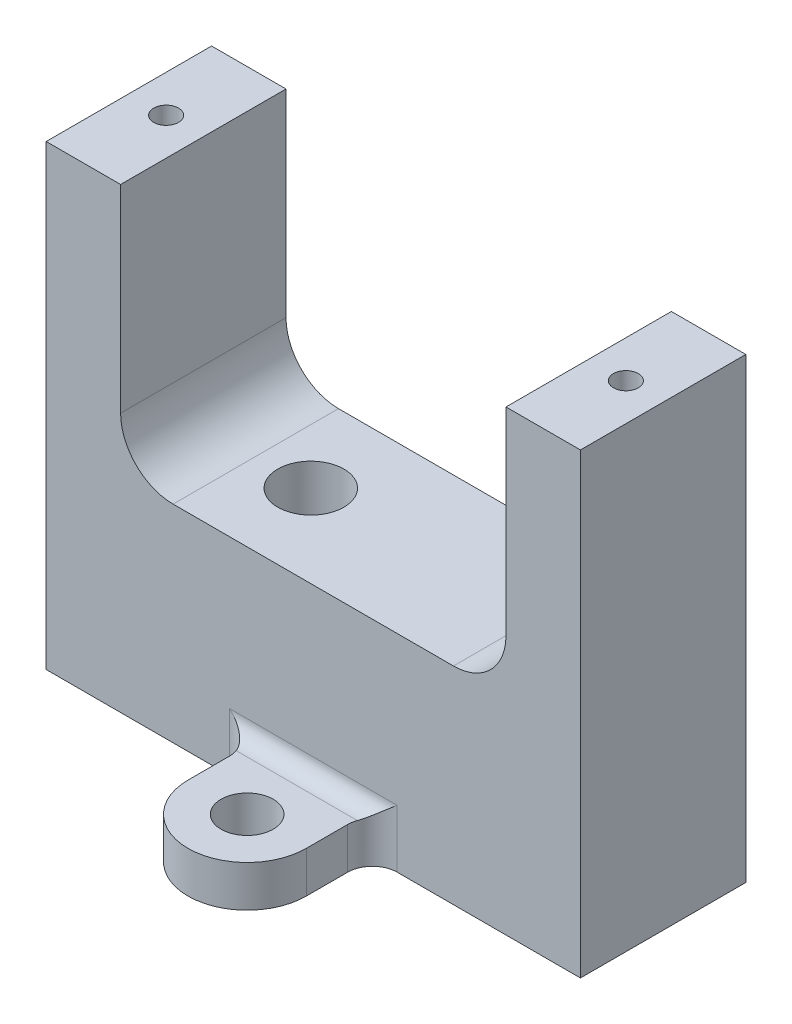
from build123d import *

# Parameters (mm, degrees)
SKETCH1_W                           = 4.5
SKETCH1_H                           = 10
BOSS_EXTRUDE1_DEPTH                 = 15.15
BOSS_EXTRUDE1_2_DEPTH               = 15.15
F_1_5_1_5_DIAMETER_HOLE1_AT_2_COUNT = 2
F_1_5_1_5_DIAMETER_HOLE1_AT_2_PITCH = 27.8
SKETCH5_W                           = 32.3
SKETCH5_H                           = 10
SKETCH5_R                           = 2
BOSS_EXTRUDE2_DEPTH                 = 12.5
FILLET1_R                           = 3.175
SKETCH6_R                           = 2
CUT_EXTRUDE1_DEPTH                  = 15.4
SKETCH7_R                           = 1.575
BOSS_EXTRUDE3_DEPTH                 = 2.5
FILLET3_R                           = 1.5
FILLET4_R                           = 1


with BuildPart() as part:
    # Sketch1 → Boss-Extrude1 (new body)
    with BuildSketch(Plane(origin=(0, 0, 0), x_dir=(1, 0, 0), z_dir=(0, 1, 0))):
        with Locations((-13.9, 0)):
            Rectangle(SKETCH1_W, SKETCH1_H)
    extrude(amount=-BOSS_EXTRUDE1_DEPTH)

    # Sketch4 → Ø1.5 (1.5) Diameter Hole1 (revolve, cut)
    with BuildSketch(Plane(origin=(-13.9, 0, 0), x_dir=(0, 0, 1), z_dir=(1, 0, 0))):
        Polygon((0, 0), (0, 8), (0.75, 7.549354536), (0.75, 0), align=None)
    f_1_5_1_5_diameter_hole1 = revolve(axis=Axis((-13.9, 6.35, 0), (0, -1, 0)), mode=Mode.SUBTRACT)



with BuildPart() as body_2:
    # Sketch1 → Boss-Extrude1 2 (new body)
    with BuildSketch(Plane(origin=(0, 0, 0), x_dir=(1, 0, 0), z_dir=(0, 1, 0))):
        with Locations((13.9, 0)):
            Rectangle(SKETCH1_W, SKETCH1_H)
    extrude(amount=-BOSS_EXTRUDE1_2_DEPTH)

    # Ø1.5 (1.5) Diameter Hole1 at 2: Ø1.5 (1.5) Diameter Hole1 ×2
    with Locations(*[(i * F_1_5_1_5_DIAMETER_HOLE1_AT_2_PITCH, 0, 0) for i in range(1, F_1_5_1_5_DIAMETER_HOLE1_AT_2_COUNT)]):
        add(f_1_5_1_5_diameter_hole1, mode=Mode.SUBTRACT)


with BuildPart() as part_1:
    add(part.part)

    add(body_2.part)  # Boss-Extrude2 merges body 2
    # Sketch5 → Boss-Extrude2 (add)
    with BuildSketch(Plane.XZ.offset(15.15)):
        Rectangle(SKETCH5_W, SKETCH5_H)
        with Locations((-5.15, 0)):
            Circle(SKETCH5_R, mode=Mode.SUBTRACT)
    extrude(amount=BOSS_EXTRUDE2_DEPTH)

    # Fillet1
    fillet1_edges = [part_1.edges().sort_by_distance(p)[0] for p in [
        (11.65, -15.15, 0),
        (-11.65, -15.15, 0),
    ]]
    fillet(fillet1_edges, radius=FILLET1_R)

    # Sketch6 → Cut-Extrude1 (cut)
    with BuildSketch(Plane.ZY.offset(16.15)):
        with Locations((-1.2, -20.65)):
            Circle(SKETCH6_R)
    extrude(amount=-CUT_EXTRUDE1_DEPTH, mode=Mode.SUBTRACT)

    # Sketch7 → Boss-Extrude3 (add)
    # profile 1 of 2: a face of its own
    with BuildSketch(Plane.XZ.offset(27.65)):
        with BuildLine():
            Line((3.575, -5), (-3.575, -5))
            Line((-3.575, -5), (-3.575, -9))
            ThreePointArc((-3.575, -9), (0, -12.575), (3.575, -9))
            Line((3.575, -9), (3.575, -5))
        make_face()
        with Locations((0, -9)):
            Circle(SKETCH7_R, mode=Mode.SUBTRACT)
    # profile 2 of 2: a face of its own
    with BuildSketch(Plane.XZ.offset(27.65)):
        with BuildLine():
            Line((-3.575, 5), (3.575, 5))
            Line((3.575, 5), (3.575, 9))
            ThreePointArc((3.575, 9), (0, 12.575), (-3.575, 9))
            Line((-3.575, 9), (-3.575, 5))
        make_face()
        with Locations((0, 9)):
            Circle(SKETCH7_R, mode=Mode.SUBTRACT)
    extrude(amount=-BOSS_EXTRUDE3_DEPTH)

    # Fillet3
    fillet3_edges = [part_1.edges().sort_by_distance(p)[0] for p in [
        (3.575, -26.4, -5),
        (-3.575, -26.4, -5),
        (-3.575, -26.4, 5),
        (3.575, -26.4, 5),
    ]]
    fillet(fillet3_edges, radius=FILLET3_R)

    # Fillet4
    fillet4_edges = [part_1.edges().sort_by_distance(p)[0] for p in [
        (0, -25.15, 5),
        (0, -25.15, -5),
    ]]
    fillet(fillet4_edges, radius=FILLET4_R)


solid = part_1.part
